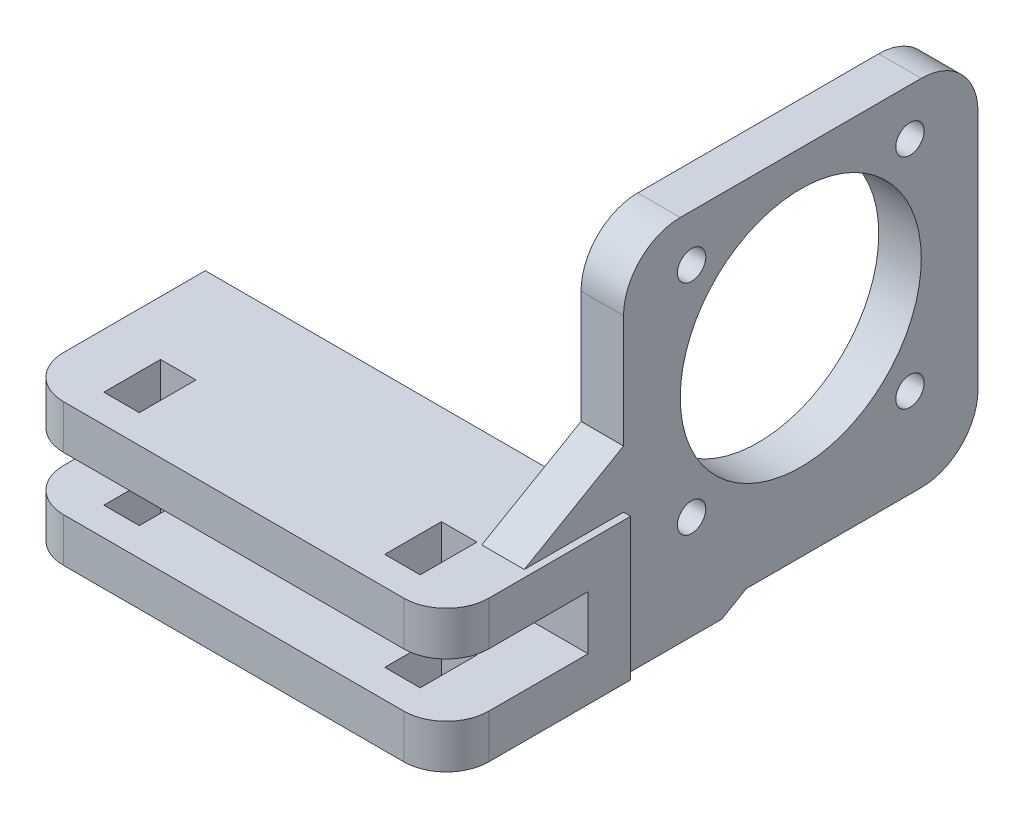
from build123d import *

# Parameters (mm, degrees)
ESBO_O1_W                  = 30
ESBO_O1_H                  = 10
RESSALTO_EXTRUS_O1_DEPTH   = 13
ESBO_O2_W                  = 30
ESBO_O2_H                  = 3.8
CORTE_EXTRUS_O1_DEPTH      = 10
FILETE1_R                  = 3
CORTE_EXTRUS_O2_DEPTH      = 23.226110771
CORTE_EXTRUS_O2_DEPTH_BACK = 23.226110771
ESBO_O3_W                  = 2.5
ESBO_O3_H                  = 4
ESBO_O4_W                  = 25
ESBO_O4_H                  = 25
RESSALTO_EXTRUS_O2_DEPTH   = 1.5
CHANFRO1_SIZE              = 5
CHANFRO1_SIZE_2            = 8.660254038
CHANFRO2_SIZE              = 7
CHANFRO2_SIZE2             = 4.041451884
ESBO_O5_R                  = 8.5
ESBO_O5_R_2                = 1
CORTE_EXTRUS_O3_DEPTH      = 3
FILETE2_R                  = 4


with BuildPart() as part:
    # Esboço1 → Ressalto-extrusão1 (new body)
    with BuildSketch(Plane.XY):
        Rectangle(ESBO_O1_W, ESBO_O1_H)
    extrude(amount=RESSALTO_EXTRUS_O1_DEPTH)

    # Esboço2 → Corte-extrusão1 (cut)
    with BuildSketch(Plane.XY.offset(13)):
        Rectangle(ESBO_O2_W, ESBO_O2_H)
    extrude(amount=-CORTE_EXTRUS_O1_DEPTH, mode=Mode.SUBTRACT)

    # Filete1
    filete1_edges = [part.edges().sort_by_distance(p)[0] for p in [
        (-15, 3.45, 13),
        (15, 3.45, 13),
        (-15, -3.45, 13),
        (15, -3.45, 13),
    ]]
    fillet(filete1_edges, radius=FILETE1_R)

    # Esboço3 → Corte-extrusão2 (cut, two sides: drawn at the far end of the back side and taken through both)
    with BuildSketch(Plane(origin=(0, 5, 0), x_dir=(1, 0, 0), z_dir=(0, 1, 0)).offset(-CORTE_EXTRUS_O2_DEPTH_BACK)):
        with Locations((9.906768391, -9)):
            Rectangle(ESBO_O3_W, ESBO_O3_H)
        with Locations((-9.906768391, -9)):
            Rectangle(ESBO_O3_W, ESBO_O3_H)
    extrude(amount=CORTE_EXTRUS_O2_DEPTH + CORTE_EXTRUS_O2_DEPTH_BACK, mode=Mode.SUBTRACT)

    # Esboço4 → Ressalto-extrusão2 (add, symmetric)
    with BuildSketch(Plane(origin=(13, 0, 0), x_dir=(0, 0, -1), z_dir=(1, 0, 0))):
        with Locations((12.5, 8.5)):
            Rectangle(ESBO_O4_W, ESBO_O4_H)
    extrude(amount=RESSALTO_EXTRUS_O2_DEPTH, both=True)

    # Chanfro1
    # the kernel refuses this chamfer: 8.660254038, 5 mm, written as the material it adds along each edge
    with BuildSketch(Plane(origin=(11.5, -4, 0), x_dir=(0, -0.9983227437537924, 0.05789386240267202), z_dir=(1, 0, 0))) as chanfro1_piece_1_section:
        Polygon((CHANFRO1_SIZE * 0.998322743754, CHANFRO1_SIZE * 0.0578938624027), (-CHANFRO1_SIZE_2 * 0.0578938624016, CHANFRO1_SIZE_2 * 0.998322743736), (0, 0), align=None)
    chanfro1_piece_1 = extrude(amount=3, mode=Mode.PRIVATE)
    chanfro1_piece_1 = split(chanfro1_piece_1, bisect_by=Plane(origin=(13, -5, -4.055902091), z_dir=(0, 1, 0)), keep=Keep.TOP, mode=Mode.PRIVATE)
    add(chanfro1_piece_1)

    # Chanfro2
    chanfro2_edges = [part.edges().sort_by_distance(p)[0] for p in [
        (13, 5, 0),
    ]]
    chanfro2_side = [part.faces().sort_by_distance(p)[0] for p in [
        (0, 5, 6.301932384),
    ]]
    chamfer(chanfro2_edges, length=CHANFRO2_SIZE, length2=CHANFRO2_SIZE2, reference=chanfro2_side[0])

    # Esboço5 → Corte-extrusão3 (cut)
    with BuildSketch(Plane.ZY.offset(-11.5)):
        with Locations((-12.5, 10)):
            Circle(ESBO_O5_R)
        with Locations((-20.2, 17.7)):
            Circle(ESBO_O5_R_2)
        with Locations((-4.8, 17.7)):
            Circle(ESBO_O5_R_2)
        with Locations((-4.8, 2.3)):
            Circle(ESBO_O5_R_2)
        with Locations((-20.2, 2.3)):
            Circle(ESBO_O5_R_2)
    extrude(amount=-CORTE_EXTRUS_O3_DEPTH, mode=Mode.SUBTRACT)

    # Filete2
    filete2_edges = [part.edges().sort_by_distance(p)[0] for p in [
        (13, 21, 0),
        (13, 21, -25),
        (13, -4, -25),
    ]]
    fillet(filete2_edges, radius=FILETE2_R)


solid = part.part
